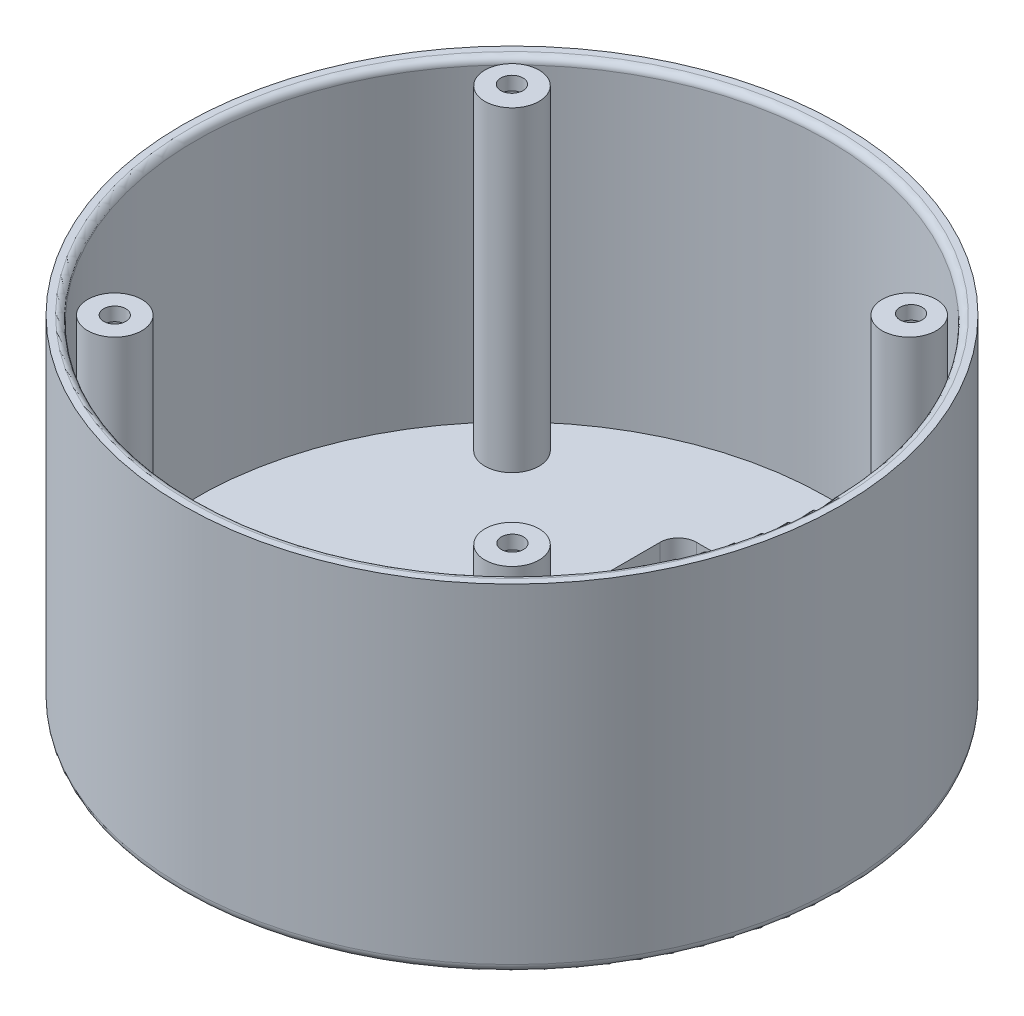
from build123d import *

# Parameters (mm, degrees)
SKETCH2_R           = 36.5
BOSS_EXTRUDE1_DEPTH = 2.5
SKETCH3_R           = 36.5
SKETCH3_R_2         = 35
BOSS_EXTRUDE2_DEPTH = 35
SKETCH4_R           = 3
BOSS_EXTRUDE3_DEPTH = 35
SKETCH5_R           = 1.225
CUT_EXTRUDE2_DEPTH  = 64.802429421
CUT_EXTRUDE7_START  = -36
SKETCH9_R           = 2.5
SKETCH9_R_2         = 1.225
CUT_EXTRUDE7_DEPTH  = 36
FILLET2_R           = 0.75
SKETCH17_W          = 10
SKETCH17_H          = 10
CUT_EXTRUDE9_DEPTH  = 10
FILLET3_R           = 2
FILLET4_R           = 2
FILLET5_R           = 2
FILLET6_R           = 2
SKETCH18_R          = 1.25
CUT_EXTRUDE10_DEPTH = 10
FILLET7_R           = 1


with BuildPart() as part:
    # Sketch2 → Boss-Extrude1 (new body)
    with BuildSketch(Plane(origin=(0, 0, 0), x_dir=(1, 0, 0), z_dir=(0, 1, 0))):
        Circle(SKETCH2_R)
    extrude(amount=BOSS_EXTRUDE1_DEPTH)

    # Sketch3 → Boss-Extrude2 (add)
    with BuildSketch(Plane(origin=(0, 2.5, 0), x_dir=(1, 0, 0), z_dir=(0, 1, 0))):
        Circle(SKETCH3_R)
        Circle(SKETCH3_R_2, mode=Mode.SUBTRACT)
    extrude(amount=BOSS_EXTRUDE2_DEPTH)

    # Sketch4 → Boss-Extrude3 (add)
    with BuildSketch(Plane(origin=(0, 2.5, 0), x_dir=(1, 0, 0), z_dir=(0, 1, 0))):
        with Locations((-22, 22)):
            Circle(SKETCH4_R)
        with Locations((22, 22)):
            Circle(SKETCH4_R)
        with Locations((22, -22)):
            Circle(SKETCH4_R)
        with Locations((-22, -22)):
            Circle(SKETCH4_R)
    extrude(amount=BOSS_EXTRUDE3_DEPTH)

    # Sketch5 → Cut-Extrude2 (cut, through all)
    with BuildSketch(Plane(origin=(0, 37.5, 0), x_dir=(1, 0, 0), z_dir=(0, 1, 0))):
        with Locations((-22, -22)):
            Circle(SKETCH5_R)
        with Locations((-22.145028028, 22.135381056)):
            Circle(SKETCH5_R)
        with Locations((21.959827612, 22.246616506)):
            Circle(SKETCH5_R)
        with Locations((21.904209888, -21.858239135)):
            Circle(SKETCH5_R)
    extrude(amount=-CUT_EXTRUDE2_DEPTH, mode=Mode.SUBTRACT)

    # Sketch9 → Cut-Extrude7 (cut)
    # profile 1 of 4: a face of its own
    with BuildSketch(Plane.XZ.offset(CUT_EXTRUDE7_START)):
        with Locations((-22, 22)):
            Circle(SKETCH9_R)
        with Locations((-22, 22)):
            Circle(SKETCH9_R_2, mode=Mode.SUBTRACT)
    # profile 2 of 4: a face of its own
    with BuildSketch(Plane.XZ.offset(CUT_EXTRUDE7_START)):
        with Locations((22, 22)):
            Circle(SKETCH9_R)
        with Locations((21.904209888, 21.858239135)):
            Circle(SKETCH9_R_2, mode=Mode.SUBTRACT)
    # profile 3 of 4: a face of its own
    with BuildSketch(Plane.XZ.offset(CUT_EXTRUDE7_START)):
        with Locations((-22, -22)):
            Circle(SKETCH9_R)
        with Locations((-22.145028028, -22.135381056)):
            Circle(SKETCH9_R_2, mode=Mode.SUBTRACT)
    # profile 4 of 4: a face of its own
    with BuildSketch(Plane.XZ.offset(CUT_EXTRUDE7_START)):
        with Locations((22, -22)):
            Circle(SKETCH9_R)
        with Locations((21.959827612, -22.246616506)):
            Circle(SKETCH9_R_2, mode=Mode.SUBTRACT)
    extrude(amount=CUT_EXTRUDE7_DEPTH, mode=Mode.SUBTRACT)

    # Fillet2
    fillet2_edges = [part.edges().sort_by_distance(p)[0] for p in [
        (-35, 37.5, 0),
    ]]
    fillet(fillet2_edges, radius=FILLET2_R)

    # Sketch17 → Cut-Extrude9 (cut)
    with BuildSketch(Plane.XZ):
        with Locations((0, -18.418957296)):
            Rectangle(SKETCH17_W, SKETCH17_H)
    extrude(amount=-CUT_EXTRUDE9_DEPTH, mode=Mode.SUBTRACT)

    # Fillet3
    fillet3_edges = [part.edges().sort_by_distance(p)[0] for p in [
        (5, 1.25, -13.418957296),
    ]]
    fillet(fillet3_edges, radius=FILLET3_R)

    # Fillet4
    fillet4_edges = [part.edges().sort_by_distance(p)[0] for p in [
        (-5, 1.25, -23.418957296),
    ]]
    fillet(fillet4_edges, radius=FILLET4_R)

    # Fillet5
    fillet5_edges = [part.edges().sort_by_distance(p)[0] for p in [
        (5, 1.25, -23.418957296),
    ]]
    fillet(fillet5_edges, radius=FILLET5_R)

    # Fillet6
    fillet6_edges = [part.edges().sort_by_distance(p)[0] for p in [
        (-5, 1.25, -13.418957296),
    ]]
    fillet(fillet6_edges, radius=FILLET6_R)

    # Sketch18 → Cut-Extrude10 (cut)
    with BuildSketch(Plane.XZ):
        Circle(SKETCH18_R)
        with Locations((2.828427125, -2.828427125)):
            Circle(SKETCH18_R)
        with Locations((5.656854249, -5.656854249)):
            Circle(SKETCH18_R)
        with Locations((8.485281374, -8.485281374)):
            Circle(SKETCH18_R)
        with Locations((2.828427125, 2.828427125)):
            Circle(SKETCH18_R)
        with Locations((5.656854249, 5.656854249)):
            Circle(SKETCH18_R)
        with Locations((8.485281374, 8.485281374)):
            Circle(SKETCH18_R)
        with Locations((-2.828427125, 2.828427125)):
            Circle(SKETCH18_R)
        with Locations((-5.656854249, 5.656854249)):
            Circle(SKETCH18_R)
        with Locations((-8.485281374, 8.485281374)):
            Circle(SKETCH18_R)
        with Locations((-2.828427125, -2.828427125)):
            Circle(SKETCH18_R)
        with Locations((-5.656854249, -5.656854249)):
            Circle(SKETCH18_R)
        with Locations((-8.485281374, -8.485281374)):
            Circle(SKETCH18_R)
    extrude(amount=-CUT_EXTRUDE10_DEPTH, mode=Mode.SUBTRACT)

    # Fillet7
    fillet7_edges = [part.edges().sort_by_distance(p)[0] for p in [
        (-36.5, 0, 0),
    ]]
    fillet(fillet7_edges, radius=FILLET7_R)


solid = part.part
